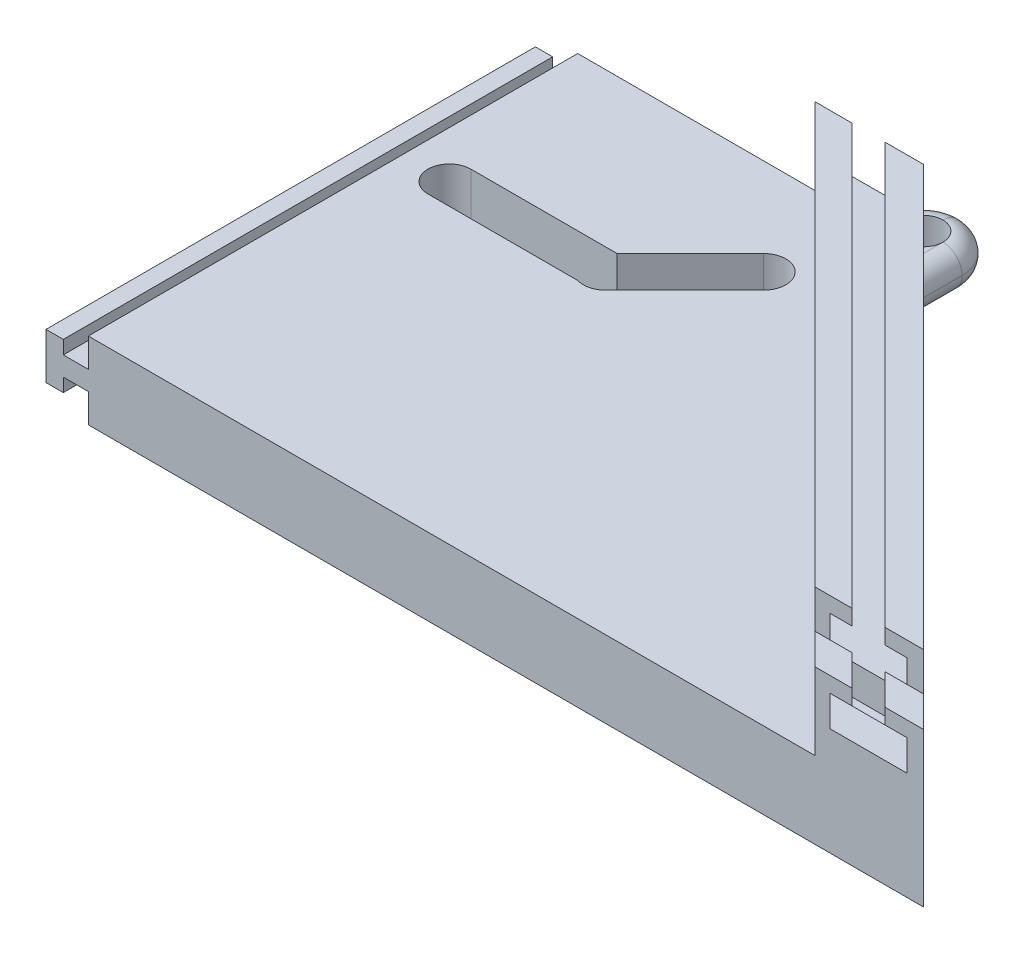
from build123d import *

# Parameters (mm, degrees)
BOSS_EXTRUDE1_DEPTH = 10
BOSS_EXTRUDE3_DEPTH = 65
SKETCH3_W           = 6.566984135
SKETCH3_H           = 1.360389693
CUT_EXTRUDE2_DEPTH  = 65
BOSS_EXTRUDE4_DEPTH = 3.25
BOSS_EXTRUDE5_DEPTH = 2.25
SKETCH7_W           = 10
SKETCH7_H           = 5
BOSS_EXTRUDE6_DEPTH = 10
SKETCH8_R           = 2.5
CUT_EXTRUDE3_DEPTH  = 10
FILLET1_R           = 5
FILLET2_R           = 5
FILLET4_R           = 2.5
FILLET5_R           = 2.5
SKETCH9_W           = 100
SKETCH9_H           = 5.5
CUT_EXTRUDE4_DEPTH  = 100
BOSS_EXTRUDE7_DEPTH = 10
CUT_EXTRUDE5_DEPTH  = 150
SKETCH12_W          = 29.92089387
SKETCH12_H          = 33.203721342
CUT_EXTRUDE6_DEPTH  = 150
SKETCH14_W          = 19.184954217
SKETCH14_H          = 28.132637814
CUT_EXTRUDE7_DEPTH  = 150
SKETCH16_W          = 15.620456736
SKETCH16_H          = 10.822807293
CUT_EXTRUDE8_DEPTH  = 150
CUT_EXTRUDE9_DEPTH  = 10
CUT_EXTRUDE10_DEPTH = 10


with BuildPart() as part:
    # Sketch1 → Boss-Extrude1 (new body)
    with BuildSketch(Plane(origin=(0, 0, 0), x_dir=(1, 0, 0), z_dir=(0, 1, 0))):
        Polygon((-11.672910159, -34.563988547), (96.966700148, -34.563988547), (33.327089841, 29.07562176), (-11.672910159, 29.07562176), align=None)
    extrude(amount=BOSS_EXTRUDE1_DEPTH)

    # Sketch2 → Boss-Extrude3 (add)
    with BuildSketch(Plane.XY.offset(34.563988547)):
        Polygon((-11.672910159, 3.75), (-14.922910159, 3.75), (-14.922910159, 2), (-17.172910159, 2), (-17.172910159, 8), (-14.922910159, 8), (-14.922910159, 6.25), (-11.672910159, 6.25), align=None)
    extrude(amount=-BOSS_EXTRUDE3_DEPTH)

    # Sketch3 → Cut-Extrude2 (cut)
    with BuildSketch(Plane(origin=(0, 8, 0), x_dir=(1, 0, 0), z_dir=(0, 1, 0))):
        with Locations((-13.889418092, 29.755816607)):
            Rectangle(SKETCH3_W, SKETCH3_H)
    extrude(amount=-CUT_EXTRUDE2_DEPTH, mode=Mode.SUBTRACT)

    # Sketch4 → Boss-Extrude4 (add)
    with BuildSketch(Plane(origin=(0, 10, 0), x_dir=(1, 0, 0), z_dir=(0, 1, 0))):
        Polygon((91.663399289, -34.563988547), (28.023788982, 29.07562176), (25.520630977, 29.07562176), (89.160241283, -34.563988547), align=None)
    extrude(amount=BOSS_EXTRUDE4_DEPTH)

    # Sketch6 → Boss-Extrude5 (add)
    with BuildSketch(Plane(origin=(0, 13.25, 0), x_dir=(1, 0, 0), z_dir=(0, 1, 0))):
        Polygon((90.411820286, -34.563988547), (94.136820286, -34.563988547), (30.497209979, 29.07562176), (23.047209979, 29.07562176), (86.686820286, -34.563988547), align=None)
    extrude(amount=BOSS_EXTRUDE5_DEPTH)

    # Sketch7 → Boss-Extrude6 (add)
    with BuildSketch(Plane(origin=(0, 0, -29.07562176), x_dir=(-1, 0, 0), z_dir=(0, 0, -1))):
        with Locations((-28.327089841, 5)):
            Rectangle(SKETCH7_W, SKETCH7_H)
    extrude(amount=BOSS_EXTRUDE6_DEPTH)

    # Sketch8 → Cut-Extrude3 (cut)
    with BuildSketch(Plane(origin=(0, 7.5, 0), x_dir=(1, 0, 0), z_dir=(0, 1, 0))):
        with Locations(Location((28.327089841, 34.07562176, 0), (0, 0, 270))):
            Circle(SKETCH8_R)
    extrude(amount=-CUT_EXTRUDE3_DEPTH, mode=Mode.SUBTRACT)

    # Fillet1
    fillet1_edges = [part.edges().sort_by_distance(p)[0] for p in [
        (23.327089841, 5, -39.07562176),
    ]]
    fillet(fillet1_edges, radius=FILLET1_R)

    # Fillet2
    fillet2_edges = [part.edges().sort_by_distance(p)[0] for p in [
        (33.327089841, 5, -39.07562176),
    ]]
    fillet(fillet2_edges, radius=FILLET2_R - 0.0001)  # a hair under: the kernel refuses the full size

    # Fillet4
    fillet4_edges = [part.edges().sort_by_distance(p)[0] for p in [
        (23.327089841, 7.5, -31.57562176),
        (33.327089841, 7.5, -31.57567176),
        (24.791555935, 7.5, -37.611155666),
    ]]
    fillet(fillet4_edges, radius=FILLET4_R - 0.0001)  # a hair under: the kernel refuses the full size

    # Fillet5
    fillet5_edges = [part.edges().sort_by_distance(p)[0] for p in [
        (23.327089841, 2.5, -31.57562176),
        (33.327089841, 2.5, -31.57567176),
        (24.791555935, 2.5, -37.611155666),
        (31.862653036, 2.5, -37.611184955),
    ]]
    fillet(fillet5_edges, radius=FILLET5_R - 0.0001)  # a hair under: the kernel refuses the full size

    # Sketch9 → Cut-Extrude4 (cut)
    with BuildSketch(Plane.XY.offset(34.563988547)):
        with Locations((44.136820286, 12.75)):
            Rectangle(SKETCH9_W, SKETCH9_H)
    extrude(amount=-CUT_EXTRUDE4_DEPTH, mode=Mode.SUBTRACT)

    # Sketch10 → Boss-Extrude7 (add)
    with BuildSketch(Plane(origin=(0, 10, 0), x_dir=(1, 0, 0), z_dir=(0, 1, 0))):
        Polygon((96.966700148, -34.563988547), (89.895632336, -41.635056358), (7.416994707, 40.84358127), (14.488062519, 47.914649082), align=None)
    extrude(amount=BOSS_EXTRUDE7_DEPTH)

    # Sketch11 → Cut-Extrude5 (cut)
    with BuildSketch(Plane(origin=(65.765344347, 0, 65.765344347), x_dir=(0.7071067811865475, 0, -0.7071067811865477), z_dir=(0.7071067811865477, 0, 0.7071067811865475))):
        Polygon((40.542543722, 20), (40.542543722, 18), (42.592543722, 18), (42.592543722, 14), (35.492543722, 14), (35.492543722, 18), (37.542543722, 18), (37.542543722, 20), align=None)
    extrude(amount=-CUT_EXTRUDE5_DEPTH, mode=Mode.SUBTRACT)

    # Sketch12 → Cut-Extrude6 (cut)
    with BuildSketch(Plane(origin=(0, 10, 0), x_dir=(-1, 0, 0), z_dir=(0, -1, 0))):
        with Locations((-34.145401152, 45.677482431)):
            Rectangle(SKETCH12_W, SKETCH12_H)
    extrude(amount=-CUT_EXTRUDE6_DEPTH, mode=Mode.SUBTRACT)


with BuildPart() as cut_extrude6_piece_1:
    # of the separate pieces the step leaves, piece 1, a body of its own (cut_extrude6_pieces)
    add(part.part.solids().sort_by_distance((30.827189841, 2.5, -29.07562176))[0])

    # Sketch16 → Cut-Extrude8 (cut)
    with BuildSketch(Plane(origin=(0, 10, 0), x_dir=(-1, 0, 0), z_dir=(0, -1, 0))):
        with Locations((-90.634792892, -39.975392193)):
            Rectangle(SKETCH16_W, SKETCH16_H)
    extrude(amount=-CUT_EXTRUDE8_DEPTH, mode=Mode.SUBTRACT)

    # Sketch17 → Cut-Extrude9 (cut)
    with BuildSketch(Plane(origin=(0, 20, 0), x_dir=(1, 0, 0), z_dir=(0, 1, 0))):
        Polygon((92.966700148, -30.563988547), (78.824564524, -30.563988547), (73.824564524, -25.563988547), (87.966700148, -25.563988547), align=None)
    extrude(amount=-CUT_EXTRUDE9_DEPTH, mode=Mode.SUBTRACT)

    # Sketch18 → Cut-Extrude10 (cut)
    with BuildSketch(Plane(origin=(0, 10, 0), x_dir=(1, 0, 0), z_dir=(0, 1, 0))):
        with BuildLine():
            Line((27.059004739, 14.493613639), (16.811162643, 4.245771544))
            ThreePointArc((16.811162643, 4.245771544), (12.674223335, 4.245771544), (12.674223335, 8.382710852))
            Line((12.674223335, 8.382710852), (22.92206543, 18.630552948))
            ThreePointArc((22.92206543, 18.630552948), (27.059004739, 18.630552948), (27.059004739, 14.493613639))
        make_face()
        with BuildLine():
            Line((14.742692989, 3.517272066), (-5.595455146, 3.517272066))
            ThreePointArc((-5.595455146, 3.517272066), (-8.392424278, 6.314241198), (-5.595455146, 9.11121033))
            Line((-5.595455146, 9.11121033), (14.742692989, 9.11121033))
            ThreePointArc((14.742692989, 9.11121033), (17.539662121, 6.314241198), (14.742692989, 3.517272066))
        make_face()
    extrude(amount=-CUT_EXTRUDE10_DEPTH, mode=Mode.SUBTRACT)


with BuildPart() as cut_extrude6_piece_2:
    # of the separate pieces the step leaves, piece 2, a body of its own (cut_extrude6_pieces)
    add(part.part.solids().sort_by_distance((7.416994707, 10, -40.84358127))[0])

    # Sketch14 → Cut-Extrude7 (cut)
    with BuildSketch(Plane(origin=(0, 10, 0), x_dir=(-1, 0, 0), z_dir=(0, -1, 0))):
        with Locations((-9.592477109, 43.141940667)):
            Rectangle(SKETCH14_W, SKETCH14_H)
    extrude(amount=-CUT_EXTRUDE7_DEPTH, mode=Mode.SUBTRACT)


solid = cut_extrude6_piece_1.part
